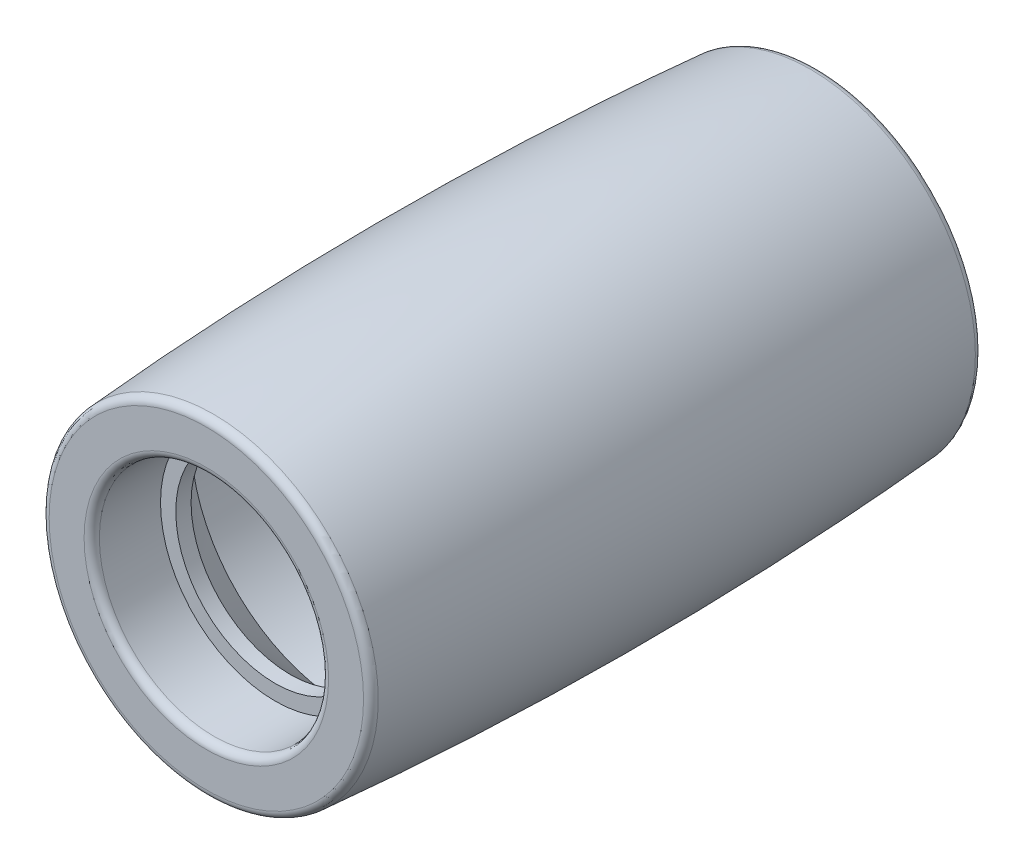
from build123d import *

# Parameters (mm, degrees)
VERRUNDUNG1_R = 1


with BuildPart() as part:
    # Skizze1 → Rotation1 (revolve)
    with BuildSketch(Plane(origin=(450, 0, 0), x_dir=(0, 0, -1), z_dir=(1, 0, 0))):
        with BuildLine():
            Line((27.712088496, 20.212088496), (49.5, 20.212088496))
            Line((49.5, 20.212088496), (49.5, 23))
            ThreePointArc((49.5, 23), (29.48594244, 22.624868257), (9.5, 21.5))
            Line((9.5, 21.5), (9.5, 15))
            Line((9.5, 15), (18.5, 15))
            Line((18.5, 15), (18.5, 13))
            Line((18.5, 13), (20.5, 13))
            Line((20.5, 13), (27.712088496, 20.212088496))
        make_face()
    revolve(axis=Axis((450, 0, 0), (0, 0, -1)))

    # Spiegeln1: part across plane


with BuildPart() as part_1:
    add(part.part)
    add(part.part.mirror(Plane(origin=(450, 23, -49.5), x_dir=(1, 0, 0), z_dir=(0, 0, 1))))

    # Verrundung1
    verrundung1_edges = [part_1.edges().sort_by_distance(p)[0] for p in [
        (450, -21.5, -9.5),
        (450, -15, -9.5),
        (450, -21.5, -89.5),
        (450, -15, -89.5),
    ]]
    fillet(verrundung1_edges, radius=VERRUNDUNG1_R)


solid = part_1.part
